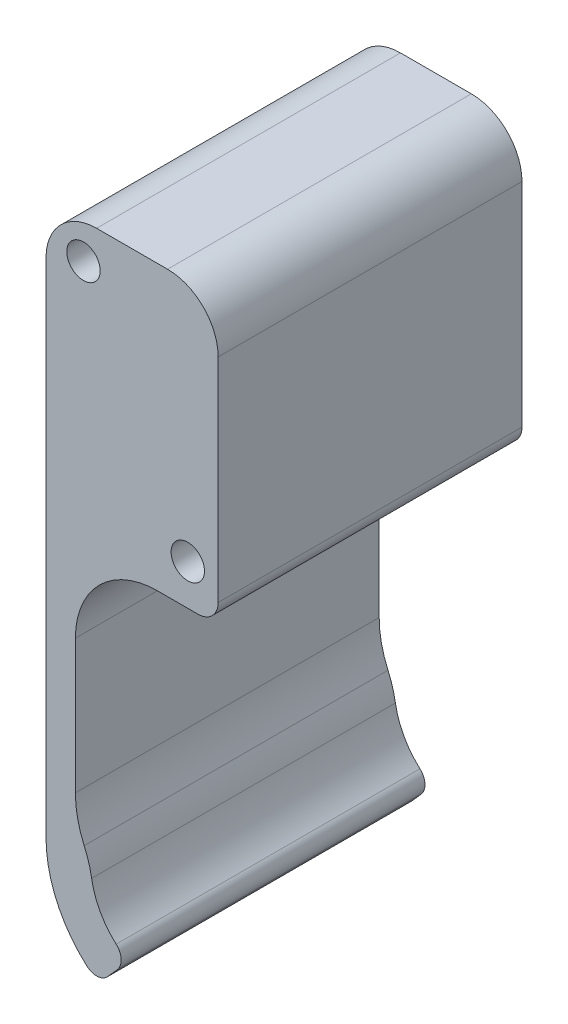
from build123d import *

# Parameters (mm, degrees)
EXTRUDE_1_DEPTH     = 30
CUT_EXTRUDE_2_DEPTH = 60.044241887
EXTRUDE_2_DEPTH     = 30
FILLET_2_R          = 10
FILLET_3_R          = 10
SKETCH_6_R          = 1.65
CUT_EXTRUDE_3_DEPTH = 60.044242053
FILLET_4_R          = 2
FILLET_6_R          = 5


with BuildPart() as part:
    # 草图2 → 凸台-拉伸1 (new body)
    with BuildSketch(Plane.XY):
        with BuildLine():
            Line((-22, 40.85), (-22, -8.75))
            ThreePointArc((-22, -8.75), (-18.485281374, -17.235281374), (-10, -20.75))
            Line((-10, -20.75), (-10, -17.85))
            ThreePointArc((-10, -17.85), (-16.434671709, -15.184671709), (-19.1, -8.75))
            Line((-19.1, -8.75), (-19.1, 9.75))
            ThreePointArc((-19.1, 9.75), (-16.727564928, 15.477564928), (-11, 17.85))
            Line((-11, 17.85), (-5, 17.85))
            Line((-5, 17.85), (-5, 45.85))
            Line((-5, 45.85), (-17, 45.85))
            ThreePointArc((-17, 45.85), (-20.535533906, 44.385533906), (-22, 40.85))
        make_face()
    extrude(amount=EXTRUDE_1_DEPTH)

    # 草图4 → 切除-拉伸2 (cut, through all)
    with BuildSketch(Plane.XY.offset(30)):
        with BuildLine():
            Line((-10, -17.85), (-10, -20.75))
            ThreePointArc((-10, -20.75), (-14.258140623, -19.969101498), (-17.962085308, -17.728039739))
            ThreePointArc((-17.962085308, -17.728039739), (-15.915153532, -17.605278578), (-16.037914692, -15.558346802))
            ThreePointArc((-16.037914692, -15.558346802), (-13.229089973, -17.257818636), (-10, -17.85))
        make_face()
    extrude(amount=-CUT_EXTRUDE_2_DEPTH, mode=Mode.SUBTRACT)

    # 草图5 → 凸台-拉伸2 (add, through all)
    with BuildSketch(Plane.XY.offset(30)):
        with BuildLine():
            Line((-17.6, -8.75), (-19.1, -8.75))
            Line((-19.1, -8.75), (-19.1, -14.554532695))
            Line((-19.1, -14.554532695), (-15.915153532, -17.605278578))
            Line((-15.915153532, -17.605278578), (-14.952977082, -16.520329338))
            ThreePointArc((-14.952977082, -16.520329338), (-14.577681338, -15.439383984), (-15.073820173, -14.408299113))
            ThreePointArc((-15.073820173, -14.408299113), (-16.939777854, -11.848303301), (-17.6, -8.75))
        make_face()
    extrude(amount=-EXTRUDE_2_DEPTH)

    # 圆角2
    # the kernel refuses this fillet: 10 mm, written as the material it adds along each edge
    with BuildSketch(Plane(origin=(-19.1, -8.75, 0), x_dir=(0, 1, 0), z_dir=(0, 0, 1))) as fillet_2_piece_1:
        with BuildLine():
            CenterArc((5.267826876, -10), FILLET_2_R, 90, 31.788330617)
            Line((0, -1.5), (-0.105356538, -1.33))
            ThreePointArc((-0.105356538, -1.33), (-0.2, -0.75), (-0.2, 0))
            Line((-0.2, 0), (0, 0.2))
            Line((0, 0.2), (5.267826876, 0.2))
            Line((5.267826876, 0.2), (5.267826876, 0))
        make_face()
    extrude(amount=30)

    # 圆角3
    fillet_3_edges = [part.edges().sort_by_distance(p)[0] for p in [
        (-17.6, -8.75, 15),
    ]]
    fillet(fillet_3_edges, radius=FILLET_3_R)

    # 草图6 → 切除-拉伸3 (cut, through all)
    with BuildSketch(Plane.XY.offset(30)):
        with Locations((-8, 21.85)):
            Circle(SKETCH_6_R)
        with Locations((-18.301374289, 42.382296182)):
            Circle(SKETCH_6_R)
    extrude(amount=-CUT_EXTRUDE_3_DEPTH, mode=Mode.SUBTRACT)

    # 圆角4
    fillet_4_edges = [part.edges().sort_by_distance(p)[0] for p in [
        (-5, 17.85, 15),
    ]]
    fillet(fillet_4_edges, radius=FILLET_4_R)

    # 圆角6
    fillet_6_edges = [part.edges().sort_by_distance(p)[0] for p in [
        (-5, 45.85, 15),
    ]]
    fillet(fillet_6_edges, radius=FILLET_6_R)


solid = part.part
